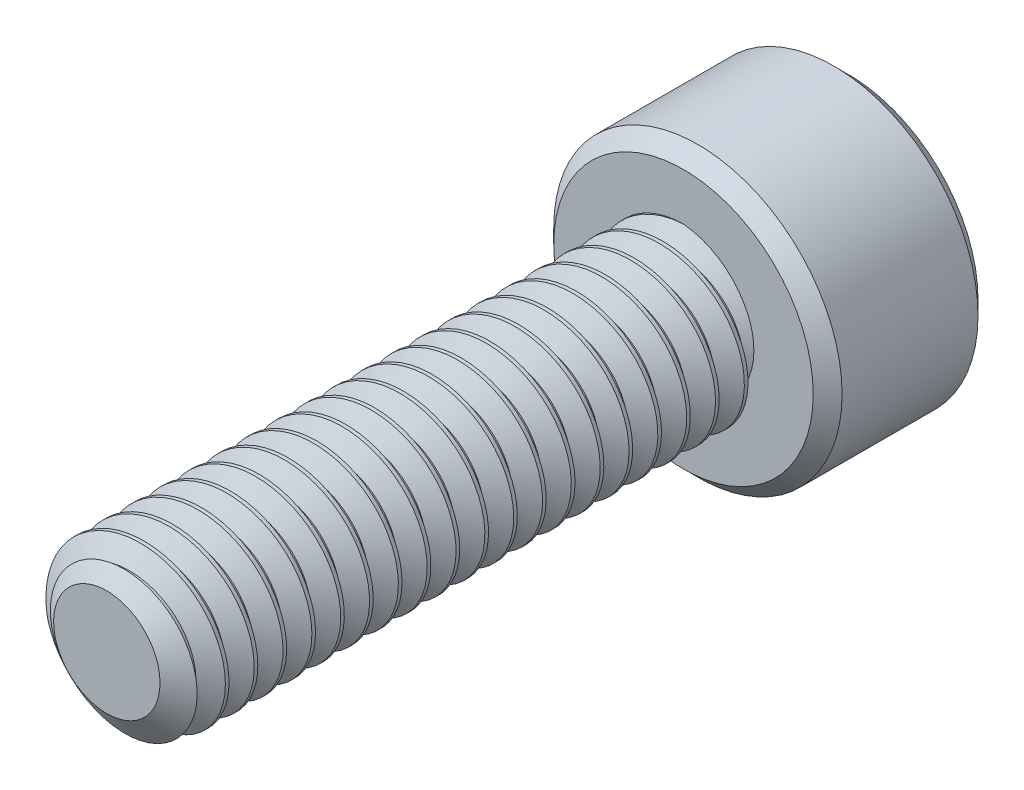
from build123d import *

# Parameters (mm, degrees)
SKETCH1_R          = 2
EXTRUDE1_DEPTH     = 14
CUT_SWEEP1_PITCH   = 0.7
SKETCH6_R          = 3.5
EXTRUDE2_DEPTH     = 4
CUT_EXTRUDE1_DEPTH = 2.25
CHAMFER1_SIZE      = 0.35


with BuildPart() as part:
    # Sketch1 → Extrude1 (new body)
    with BuildSketch(Plane.XY):
        Circle(SKETCH1_R)
    extrude(amount=-EXTRUDE1_DEPTH)

    # Cut-Sweep1: the profile of Sketch3 profile screwed along a right-hand helix of 21 turns, 6 arcs to a turn; built about Z, then put on its axis
    cut_sweep1_z = Axis((0, 0, 0), (0, 0, 1))
    cut_sweep1_corners = [(2.0003, 0, -0.612673205), (1.545336663, 0, -0.35), (1.545336663, 0, -0.2625), (2.0003, 0, 0.000173205)]
    with BuildLine(mode=Mode.PRIVATE) as cut_sweep1_profile:
        Line(cut_sweep1_corners[0], cut_sweep1_corners[1])
        Line(cut_sweep1_corners[1], cut_sweep1_corners[2])
        Line(cut_sweep1_corners[2], cut_sweep1_corners[3])
        Line(cut_sweep1_corners[3], cut_sweep1_corners[0])
    cut_sweep1_cap = Face(cut_sweep1_profile.wire())
    cut_sweep1_turn_angles = [0, 30, 60, 90, 120, 150, 180, 210, 240, 270, 300, 330, 360]
    cut_sweep1_turn_weights = [1, 0.8660254037844387, 1, 0.8660254037844387, 1, 0.8660254037844387, 1, 0.8660254037844387, 1, 0.8660254037844387, 1, 0.8660254037844387, 1]
    cut_sweep1_turn_rails = [Edge.make_bspline([Vector(p[0], p[1], 0).rotate(cut_sweep1_z, cut_sweep1_turn_angles[k]) / cut_sweep1_turn_weights[k] + Vector(0, 0, p[2] + CUT_SWEEP1_PITCH * cut_sweep1_turn_angles[k] / 360) for k in range(13)], [0, 0, 0, 1, 1, 2, 2, 3, 3, 4, 4, 5, 5, 6, 6, 6], 2, cut_sweep1_turn_weights) for p in cut_sweep1_corners]
    cut_sweep1_turn_sides = [Face.make_surface_from_curves(cut_sweep1_turn_rails[p[0]], cut_sweep1_turn_rails[p[1]]) for p in [(0, 1), (1, 2), (2, 3), (3, 0)]]
    cut_sweep1 = Plane(origin=(0, 0, 0), x_dir=(0, 1, 0), z_dir=(0, 0, -1)) * Solid(Shell([*[p.moved(Location((0, 0, CUT_SWEEP1_PITCH * i))) for i in range(21) for p in cut_sweep1_turn_sides], cut_sweep1_cap, cut_sweep1_cap.rotate(cut_sweep1_z, 7560).moved(Location((0, 0, CUT_SWEEP1_PITCH * 7560 / 360)))]))
    add(cut_sweep1, mode=Mode.SUBTRACT)

    # Sketch4 → Cut-Revolve1 (revolve, cut)
    with BuildSketch(Plane(origin=(0, 0, 0), x_dir=(0, 0, -1), z_dir=(1, 0, 0)), mode=Mode.PRIVATE) as cut_revolve1_sk:
        Polygon((0.496211411, 2), (0, 1.291336663), (0, 2), align=None)
    revolve(cut_revolve1_sk.sketch.rotate(Axis((0, 0, 0), (0, 0, -1)), 271.401126896), axis=Axis((0, 0, 0), (0, 0, -1)), mode=Mode.SUBTRACT)

    # Sketch6 → Extrude2 (add)
    with BuildSketch(Plane(origin=(0, 0, -14), x_dir=(-1, 0, 0), z_dir=(0, 0, -1))):
        Circle(SKETCH6_R)
    extrude(amount=EXTRUDE2_DEPTH)

    # Sketch7 → Cut-Extrude1 (cut)
    with BuildSketch(Plane(origin=(0, 0, -18), x_dir=(-1, 0, 0), z_dir=(0, 0, -1))):
        Polygon((0, 1.732050808), (-1.5, 0.866025404), (-1.5, -0.866025404), (0, -1.732050808), (1.5, -0.866025404), (1.5, 0.866025404), align=None)
    extrude(amount=-CUT_EXTRUDE1_DEPTH, mode=Mode.SUBTRACT)

    # Cut-Extrude2 cone 1 section (through the dimple's axis) → Cut-Extrude2 (revolve, cut)
    with BuildSketch(Plane(origin=(0, 0, -18), x_dir=(0, 1, 0), z_dir=(1, 0, 0))):
        Polygon((0, 0), (1.732050808, 0), (0, 1.732050808), align=None)
    revolve(axis=Axis((0, 0, -18), (0, 0, 1)), mode=Mode.SUBTRACT)

    # Chamfer1
    chamfer1_edges = [part.edges().sort_by_distance(p)[0] for p in [
        (3.5, 0, -14),
        (3.5, 0, -18),
    ]]
    chamfer(chamfer1_edges, length=CHAMFER1_SIZE)


solid = part.part
